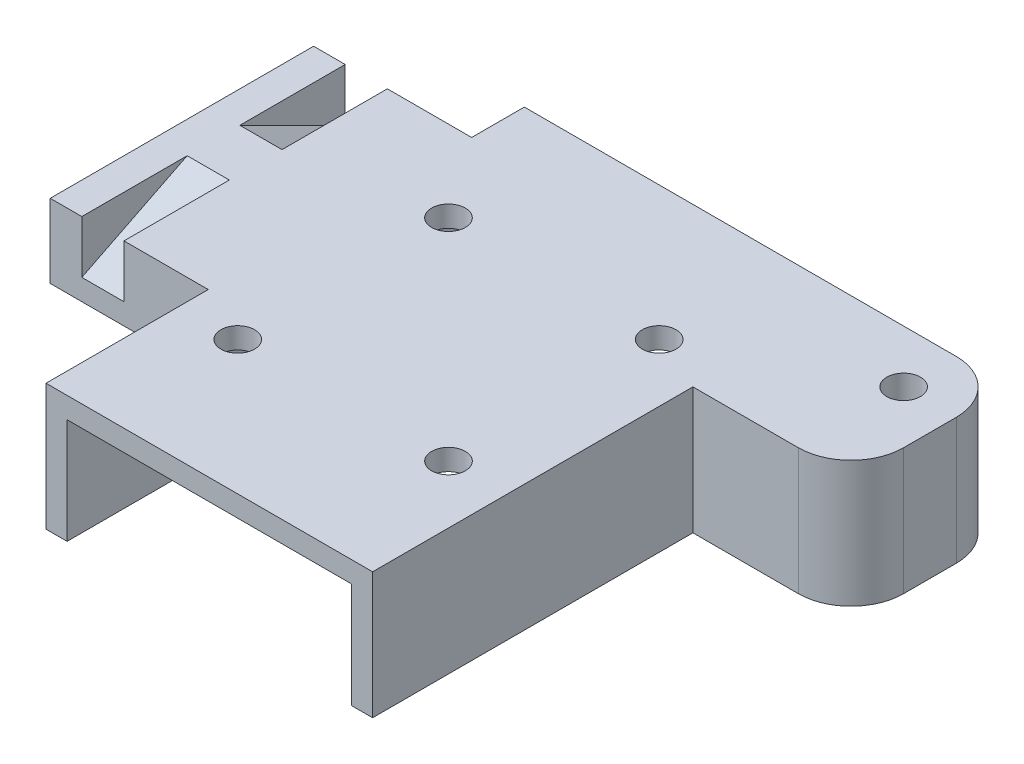
from build123d import *

# Parameters (mm, degrees)
SKETCH1_W           = 31
SKETCH1_H           = 45.4
BOSS_EXTRUDE1_DEPTH = 12
SKETCH2_W           = 27
SKETCH2_H           = 10
CUT_EXTRUDE1_DEPTH  = 57.268641356
SKETCH3_R           = 1.6
CUT_EXTRUDE2_DEPTH  = 10
SKETCH4_W           = 15
SKETCH4_H           = 12
BOSS_EXTRUDE2_DEPTH = 15
SKETCH5_R           = 1.6
CUT_EXTRUDE3_DEPTH  = 20
FILLET1_R           = 5
BOSS_EXTRUDE3_DEPTH = 15
CHAMFER1_SIZE       = 5
CUT_EXTRUDE4_DEPTH  = 4


with BuildPart() as part:
    # Sketch1 → Boss-Extrude1 (new body)
    with BuildSketch(Plane(origin=(0, 0, 0), x_dir=(1, 0, 0), z_dir=(0, 1, 0))):
        with Locations((15.5, 22.7)):
            Rectangle(SKETCH1_W, SKETCH1_H)
    extrude(amount=BOSS_EXTRUDE1_DEPTH)

    # Sketch2 → Cut-Extrude1 (cut, through all)
    with BuildSketch(Plane.XY):
        with Locations((15.5, 5)):
            Rectangle(SKETCH2_W, SKETCH2_H)
    extrude(amount=-CUT_EXTRUDE1_DEPTH, mode=Mode.SUBTRACT)

    # Sketch3 → Cut-Extrude2 (cut)
    with BuildSketch(Plane(origin=(0, 12, 0), x_dir=(1, 0, 0), z_dir=(0, 1, 0))):
        with Locations(Location((5.5, 32.7, 0), (0, 0, 270))):
            Circle(SKETCH3_R)
        with Locations(Location((25.5, 32.7, 0), (0, 0, 270))):
            Circle(SKETCH3_R)
        with Locations(Location((25.5, 12.7, 0), (0, 0, 270))):
            Circle(SKETCH3_R)
        with Locations(Location((5.5, 12.7, 0), (0, 0, 270))):
            Circle(SKETCH3_R)
    extrude(amount=-CUT_EXTRUDE2_DEPTH, mode=Mode.SUBTRACT)

    # Sketch4 → Boss-Extrude2 (add)
    with BuildSketch(Plane.ZY):
        with Locations((-7.5, 6)):
            Rectangle(SKETCH4_W, SKETCH4_H)
    extrude(amount=BOSS_EXTRUDE2_DEPTH)

    # Sketch5 → Cut-Extrude3 (cut)
    with BuildSketch(Plane(origin=(0, 12, 0), x_dir=(1, 0, 0), z_dir=(0, 1, 0))):
        with Locations(Location((-10, 5, 0), (0, 0, 270))):
            Circle(SKETCH5_R)
    extrude(amount=-CUT_EXTRUDE3_DEPTH, mode=Mode.SUBTRACT)

    # Fillet1
    fillet1_edges = [part.edges().sort_by_distance(p)[0] for p in [
        (-15, 6, -15),
        (-15, 6, 0),
    ]]
    fillet(fillet1_edges, radius=FILLET1_R)

    # Sketch6 → Boss-Extrude3 (add)
    with BuildSketch(Plane(origin=(31, 0, 0), x_dir=(0, 0, -1), z_dir=(1, 0, 0))):
        Polygon((5, 0), (10, 0), (10, 4.7), (25, 4.7), (25, 0), (30, 0), (30, 12), (5, 12), align=None)
    extrude(amount=BOSS_EXTRUDE3_DEPTH)

    # Chamfer1
    chamfer1_edges = [part.edges().sort_by_distance(p)[0] for p in [
        (38.5, 0, -5),
        (38.5, 0, -30),
    ]]
    chamfer(chamfer1_edges, length=CHAMFER1_SIZE - 0.0001)  # a hair under: the kernel refuses the full size

    # Sketch7 → Cut-Extrude4 (cut)
    with BuildSketch(Plane(origin=(43, 0, 0), x_dir=(0, 0, -1), z_dir=(1, 0, 0))):
        Polygon((5, 7), (15, 12), (5, 12), align=None)
        Polygon((30, 7), (20, 12), (30, 12), align=None)
    extrude(amount=-CUT_EXTRUDE4_DEPTH, mode=Mode.SUBTRACT)


with BuildPart() as body_2:
    # Mirror2: mirrored copy
    add(part.part.mirror(Plane(origin=(31, 12, 0), x_dir=(0, 0, 1), z_dir=(-1, 0, 0))))


with BuildPart() as body_3:
    # Mirror3: mirrored copy
    add(body_2.part.mirror(Plane(origin=(62, 12, -45.4), x_dir=(1, 0, 0), z_dir=(0, 0, 1))))


solid = body_3.part
